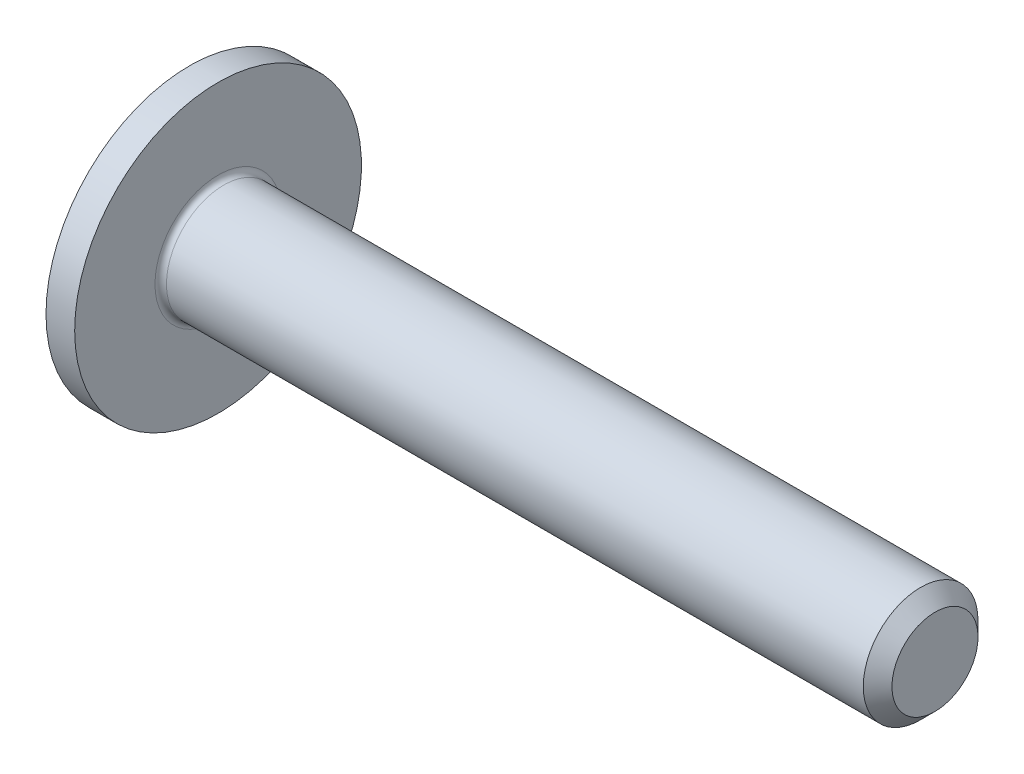
from build123d import *

# Parameters (mm, degrees)
FILLET1_R             = 0.2
RECPAT_COUNT          = 2
RECPAT_ANGLE          = 90
CHAMFER_1_SIZE        = 0.5
CUT_EXTRUDE_START     = -1.932317225
CUT_EXTRUDE_1_DEPTH   = 0.992538955
CUT_EXTRUDE_1_2_DEPTH = 0.992538955
CUT_EXTRUDE_1_3_DEPTH = 0.992538955
CUT_EXTRUDE_1_4_DEPTH = 0.992538955


# Read off the part's stored shape, not the designer's step: Вытянуть1
with BuildPart() as part:
    # BodySke → Base-Revolve (revolve)
    with BuildSketch(Plane.XY, mode=Mode.PRIVATE) as base_revolve_sk:
        Polygon((3.05, 2), (3.05, 5), (2.05, 5), (2.05, 0), (28.05, 0), (28.05, 2), align=None)
    revolve(base_revolve_sk.sketch.rotate(Axis((-6.35, 0, 0), (1, 0, 0)), 90), axis=Axis((-6.35, 0, 0), (1, 0, 0)))

    # Fillet1
    fillet1_edges = [part.edges().sort_by_distance(p)[0] for p in [
        (3.05, 0, -2),
    ]]
    fillet(fillet1_edges, radius=FILLET1_R)

    # PanSke → Pan (revolve)
    with BuildSketch(Plane.XY):
        with BuildLine():
            Line((2.05, 4.424646879), (2.05, 0))
            Line((2.05, 0), (0, 0))
            ThreePointArc((0, 0), (0.537396082, 2.438237068), (2.05, 4.424646879))
        make_face()
    revolve(axis=Axis((0, 0, 0), (1, 0, 0)))

    # Sketch3 → Recess section 0
    with BuildSketch(Plane(origin=(0, 0, 0), x_dir=(0, 0, -1), z_dir=(1, 0, 0))):
        with BuildLine():
            Line((-0.515, 2.15), (0.515, 2.15))
            Line((0.515, 2.15), (0.515, -2.15))
            Line((0.515, -2.15), (-0.515, -2.15))
            Line((-0.515, -2.15), (-0.515, 2.15))
        make_face()
    # Sketch4 → Recess section 1
    with BuildSketch(Plane(origin=(2.34, 0, 0), x_dir=(0, 0, -1), z_dir=(1, 0, 0))):
        with BuildLine():
            Line((-0.37, 1.45), (0.37, 1.45))
            Line((0.37, 1.45), (0.37, -1.45))
            Line((0.37, -1.45), (-0.37, -1.45))
            Line((-0.37, -1.45), (-0.37, 1.45))
        make_face()
    recess = loft(mode=Mode.SUBTRACT)

    # RecPat: Recess ×2 about axis
    recpat_axis = Axis((0, 0, 0), (1, 0, 0))
    for i in range(1, RECPAT_COUNT):
        add(recess.rotate(recpat_axis, i * RECPAT_ANGLE / (RECPAT_COUNT - 1)), mode=Mode.SUBTRACT)

    # RecCorSke → RecessCore (revolve, cut)
    with BuildSketch(Plane.XY, mode=Mode.PRIVATE) as recesscore_sk:
        Polygon((0, 0), (0, 1.032809711), (2.6, 0.851), (2.876506661, 0), align=None)
    revolve(recesscore_sk.sketch.rotate(Axis((-3.175, 0, 0), (1, 0, 0)), 90), axis=Axis((-3.175, 0, 0), (1, 0, 0)), mode=Mode.SUBTRACT)

    # Фаска1
    chamfer_1_edges = [part.edges().sort_by_distance(p)[0] for p in [
        (28.05, 0, -2),
    ]]
    chamfer(chamfer_1_edges, length=CHAMFER_1_SIZE)

    # Вытянуть1 outline → Вытянуть1 (cut)
    with BuildSketch(Plane(origin=(0, 0, 0), x_dir=(0.9932989193126689, -0.08172287590474318, -0.08172287590474292), z_dir=(0.11557359946062105, 0.7023684015912586, 0.7023684015912564)).offset(CUT_EXTRUDE_START)):
        Polygon((-1, -0.919204654), (0.206895578, -0.216114133), (0.577867997, 0), (0.206895578, 0.216114133), (-1, 0.919204654), align=None)
    extrude(amount=CUT_EXTRUDE_1_DEPTH, mode=Mode.SUBTRACT)

    # Cut-Extrude 1 2 outline → Cut-Extrude 1 2 (cut)
    with BuildSketch(Plane(origin=(0, 0, 0), x_dir=(0.9932989193126689, -0.08172287590474318, 0.08172287590474292), z_dir=(0.11557359946062105, 0.7023684015912586, -0.7023684015912564)).offset(CUT_EXTRUDE_START)):
        Polygon((0.206895578, -0.216114133), (0.577867997, 0), (0.206895578, 0.216114133), (-1, 0.919204654), (-1, -0.919204654), align=None)
    extrude(amount=CUT_EXTRUDE_1_2_DEPTH, mode=Mode.SUBTRACT)

    # Cut-Extrude 1 3 outline → Cut-Extrude 1 3 (cut)
    with BuildSketch(Plane(origin=(0, 0, 0), x_dir=(0.9932989193126689, 0.08172287590474318, 0.08172287590474292), z_dir=(0.11557359946062105, -0.7023684015912586, -0.7023684015912564)).offset(CUT_EXTRUDE_START)):
        Polygon((0.206895578, -0.216114133), (0.577867997, 0), (0.206895578, 0.216114133), (-1, 0.919204654), (-1, -0.919204654), align=None)
    extrude(amount=CUT_EXTRUDE_1_3_DEPTH, mode=Mode.SUBTRACT)

    # Cut-Extrude 1 4 outline → Cut-Extrude 1 4 (cut)
    with BuildSketch(Plane(origin=(0, 0, 0), x_dir=(0.9932989193126689, 0.08172287590474318, -0.08172287590474292), z_dir=(0.11557359946062105, -0.7023684015912586, 0.7023684015912564)).offset(CUT_EXTRUDE_START)):
        Polygon((-1, -0.919204654), (0.206895578, -0.216114133), (0.577867997, 0), (0.206895578, 0.216114133), (-1, 0.919204654), align=None)
    extrude(amount=CUT_EXTRUDE_1_4_DEPTH, mode=Mode.SUBTRACT)


solid = part.part
